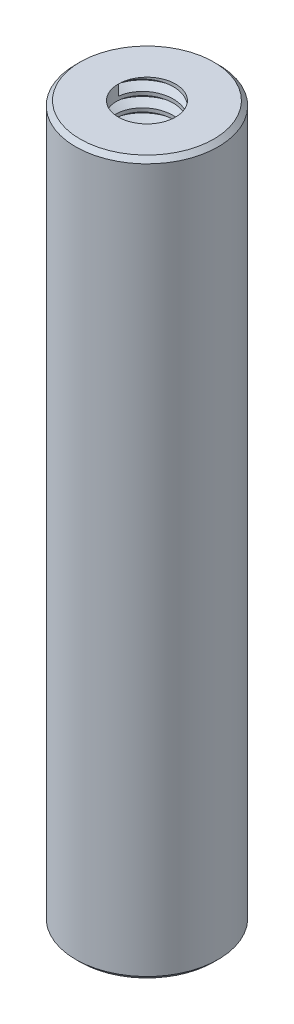
from build123d import *
from build123d.topology import SkipClean

# Parameters (mm, degrees)
CROQUIS2_R              = 6.35
SALIENTE_EXTRUIR1_DEPTH = 31.75
CHAFL_N1_SIZE           = 0.396875
TAP_START               = 31.75
CROQUIS3_R              = 2.5527
TAP_HOLE_1_DEPTH        = 19.05
TAP_START_2             = -12.7
CROQUIS3_2_R            = 2.5527
TAP_HOLE_2_DEPTH        = 19.05
ROSCA1_PITCH            = 1.27
ROSCA2_PITCH            = 1.27


with BuildPart() as part:
    # Croquis2 → Saliente-Extruir1 (new, symmetric)
    with BuildSketch(Plane(origin=(0, 0, 0), x_dir=(1, 0, 0), z_dir=(0, 1, 0))):
        with Locations(Location((0, 0, 0), (0, 0, 270))):
            Circle(CROQUIS2_R)
    extrude(amount=SALIENTE_EXTRUIR1_DEPTH, both=True)

    # Chaflán1
    chafl_n1_edges = [part.edges().sort_by_distance(p)[0] for p in [
        (0, -31.75, -6.35),
        (0, 31.75, -6.35),
    ]]
    chamfer(chafl_n1_edges, length=CHAFL_N1_SIZE)

    # Croquis3 → Tap Hole 1 (cut)
    with BuildSketch(Plane(origin=(0, 0, 0), x_dir=(1, 0, 0), z_dir=(0, 1, 0)).offset(TAP_START)):
        with Locations(Location((0, 0, 0), (0, 0, 270))):
            Circle(CROQUIS3_R)
    extrude(amount=-TAP_HOLE_1_DEPTH, mode=Mode.SUBTRACT)

    # Croquis3<2> → Tap Hole 2 (cut)
    with BuildSketch(Plane(origin=(0, 0, 0), x_dir=(1, 0, 0), z_dir=(0, 1, 0)).offset(TAP_START_2)):
        with Locations(Location((0, 0, 0), (0, 0, 270))):
            Circle(CROQUIS3_2_R)
    extrude(amount=-TAP_HOLE_2_DEPTH, mode=Mode.SUBTRACT)

    # Rosca1: the profile of Perfil de rosca1 profile screwed along a right-hand helix of 15 turns, 8 arcs to a turn; built about Z, then put on its axis
    with SkipClean():  # the faces are left unmerged after this step: merging them gives an invalid solid
        rosca1_z = Axis((0, 0, 0), (0, 0, 1))
        rosca1_corners = [(2.5524, 0, -0.000173205), (3.240107661, 0, 0.396874998), (3.240107661, 0, 0.555624998), (2.5524, 0, 0.952673202)]
        with BuildLine(mode=Mode.PRIVATE) as rosca1_profile:
            Line(rosca1_corners[0], rosca1_corners[1])
            Line(rosca1_corners[1], rosca1_corners[2])
            Line(rosca1_corners[2], rosca1_corners[3])
            Line(rosca1_corners[3], rosca1_corners[0])
        rosca1_cap = Face(rosca1_profile.wire())
        rosca1_turn_angles = [0, 22.5, 45, 67.5, 90, 112.5, 135, 157.5, 180, 202.5, 225, 247.5, 270, 292.5, 315, 337.5, 360]
        rosca1_turn_weights = [1, 0.9238795325112867, 1, 0.9238795325112867, 1, 0.9238795325112867, 1, 0.9238795325112867, 1, 0.9238795325112867, 1, 0.9238795325112867, 1, 0.9238795325112867, 1, 0.9238795325112867, 1]
        rosca1_turn_rails = [Edge.make_bspline([Vector(p[0], p[1], 0).rotate(rosca1_z, rosca1_turn_angles[k]) / rosca1_turn_weights[k] + Vector(0, 0, p[2] + ROSCA1_PITCH * rosca1_turn_angles[k] / 360) for k in range(17)], [0, 0, 0, 1, 1, 2, 2, 3, 3, 4, 4, 5, 5, 6, 6, 7, 7, 8, 8, 8], 2, rosca1_turn_weights) for p in rosca1_corners]
        rosca1_turn_sides = [Face.make_surface_from_curves(rosca1_turn_rails[p[0]], rosca1_turn_rails[p[1]]) for p in [(0, 1), (1, 2), (2, 3), (3, 0)]]
        rosca1 = Plane(origin=(0, 31.75, 0), x_dir=(-1, 0, 0), z_dir=(0, -1, 0)) * Solid(Shell([*[p.moved(Location((0, 0, ROSCA1_PITCH * i))) for i in range(15) for p in rosca1_turn_sides], rosca1_cap, rosca1_cap.rotate(rosca1_z, 5400).moved(Location((0, 0, ROSCA1_PITCH * 5400 / 360)))]))
        add(rosca1, mode=Mode.SUBTRACT)

    # Rosca2: the profile of Perfil de rosca2 profile screwed along a right-hand helix of 15 turns, 8 arcs to a turn; built about Z, then put on its axis
    with SkipClean():  # the faces are left unmerged after this step: merging them gives an invalid solid
        rosca2_z = Axis((0, 0, 0), (0, 0, 1))
        rosca2_corners = [(2.5524, 0, -0.000173205), (3.240107661, 0, 0.396874998), (3.240107661, 0, 0.555624998), (2.5524, 0, 0.952673202)]
        with BuildLine(mode=Mode.PRIVATE) as rosca2_profile:
            Line(rosca2_corners[0], rosca2_corners[1])
            Line(rosca2_corners[1], rosca2_corners[2])
            Line(rosca2_corners[2], rosca2_corners[3])
            Line(rosca2_corners[3], rosca2_corners[0])
        rosca2_cap = Face(rosca2_profile.wire())
        rosca2_turn_angles = [0, 22.5, 45, 67.5, 90, 112.5, 135, 157.5, 180, 202.5, 225, 247.5, 270, 292.5, 315, 337.5, 360]
        rosca2_turn_weights = [1, 0.9238795325112867, 1, 0.9238795325112867, 1, 0.9238795325112867, 1, 0.9238795325112867, 1, 0.9238795325112867, 1, 0.9238795325112867, 1, 0.9238795325112867, 1, 0.9238795325112867, 1]
        rosca2_turn_rails = [Edge.make_bspline([Vector(p[0], p[1], 0).rotate(rosca2_z, rosca2_turn_angles[k]) / rosca2_turn_weights[k] + Vector(0, 0, p[2] + ROSCA2_PITCH * rosca2_turn_angles[k] / 360) for k in range(17)], [0, 0, 0, 1, 1, 2, 2, 3, 3, 4, 4, 5, 5, 6, 6, 7, 7, 8, 8, 8], 2, rosca2_turn_weights) for p in rosca2_corners]
        rosca2_turn_sides = [Face.make_surface_from_curves(rosca2_turn_rails[p[0]], rosca2_turn_rails[p[1]]) for p in [(0, 1), (1, 2), (2, 3), (3, 0)]]
        rosca2 = Plane(origin=(0, -31.75, 0), x_dir=(1, 0, 0), z_dir=(0, 1, 0)) * Solid(Shell([*[p.moved(Location((0, 0, ROSCA2_PITCH * i))) for i in range(15) for p in rosca2_turn_sides], rosca2_cap, rosca2_cap.rotate(rosca2_z, 5400).moved(Location((0, 0, ROSCA2_PITCH * 5400 / 360)))]))
        add(rosca2, mode=Mode.SUBTRACT)


solid = part.part
